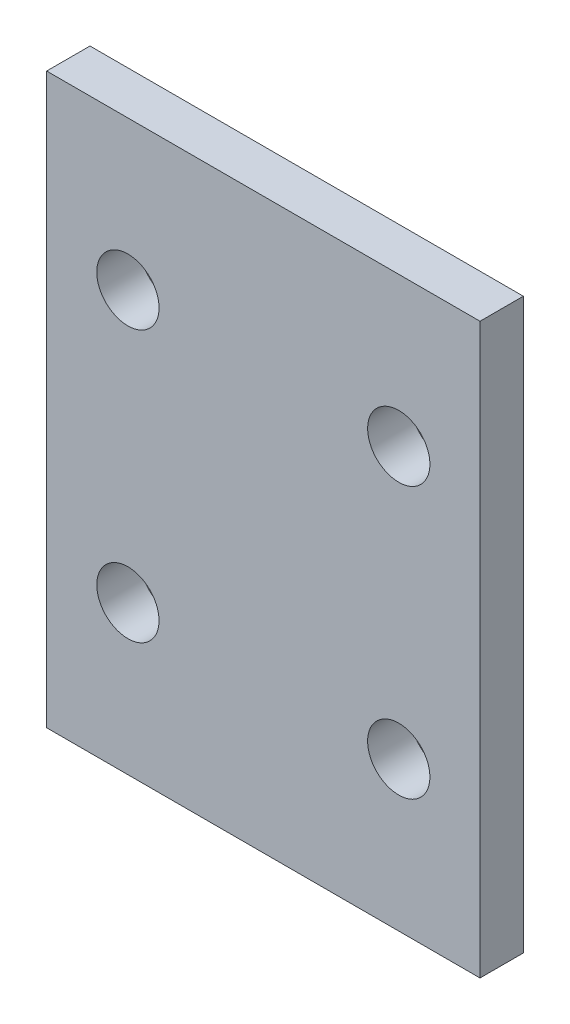
from build123d import *

# Parameters (mm, degrees)
SKETCH_1_W             = 160
SKETCH_1_H             = 210
SKETCH_1_R             = 11.5
SM_BASE_FLANGE_1_DEPTH = 16


# Sheet-metal steps are written as plain solids
with BuildPart() as part:
    # Sketch 1 → Базовая кромка1 (new body)
    with BuildSketch(Plane.XY):
        with Locations((80, -105)):
            Rectangle(SKETCH_1_W, SKETCH_1_H)
        with Locations((30, -55)):
            Circle(SKETCH_1_R, mode=Mode.SUBTRACT)
        with Locations(Location((130, -55, 0), (0, 0, 180))):
            Circle(SKETCH_1_R, mode=Mode.SUBTRACT)
        with Locations((130, -155)):
            Circle(SKETCH_1_R, mode=Mode.SUBTRACT)
        with Locations(Location((30, -155, 0), (0, 0, 180))):
            Circle(SKETCH_1_R, mode=Mode.SUBTRACT)
    extrude(amount=-SM_BASE_FLANGE_1_DEPTH)


solid = part.part
